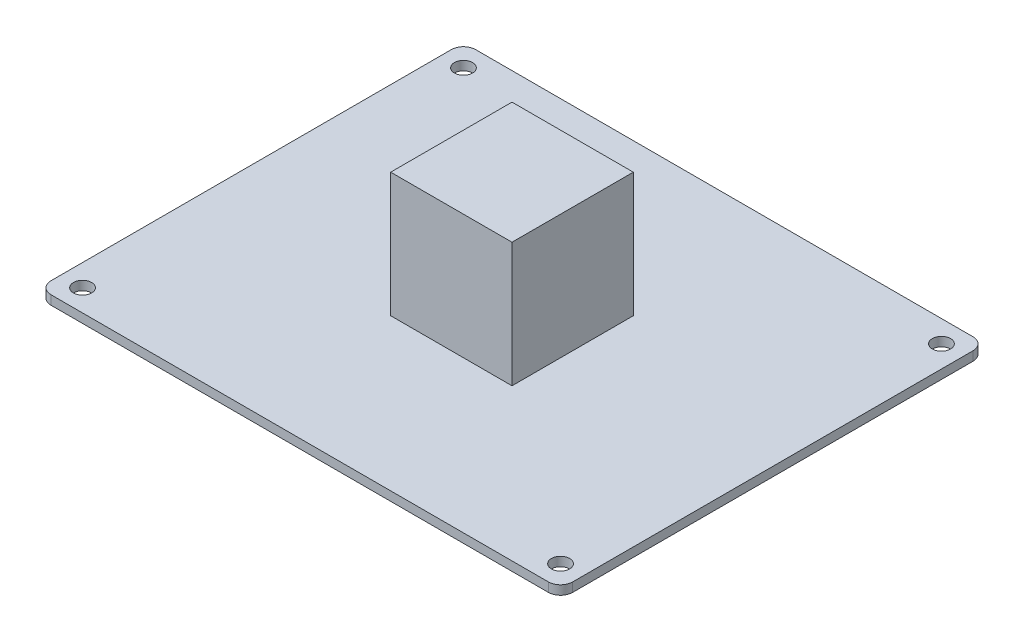
from build123d import *

# Parameters (mm, degrees)
SKETCH1_W             = 86
SKETCH1_H             = 70
BOSS_EXTRUDE1_DEPTH   = 1.5
FILLET1_R             = 2
SKETCH2_W             = 20
SKETCH2_H             = 20
BOSS_EXTRUDE2_DEPTH   = 22
F_1_0MM_DOWEL_HOLE1_D = 3


with BuildPart() as part:
    # Sketch1 → Boss-Extrude1 (new body)
    with BuildSketch(Plane(origin=(0, 0, 0), x_dir=(1, 0, 0), z_dir=(0, 1, 0))):
        Rectangle(SKETCH1_W, SKETCH1_H)
    extrude(amount=BOSS_EXTRUDE1_DEPTH)

    # Fillet1
    fillet1_edges = [part.edges().sort_by_distance(p)[0] for p in [
        (-43, 0.75, 35),
        (-43, 0.75, -35),
        (43, 0.75, -35),
        (43, 0.75, 35),
    ]]
    fillet(fillet1_edges, radius=FILLET1_R)

    # Sketch2 → Boss-Extrude2 (add)
    with BuildSketch(Plane.XZ):
        Rectangle(SKETCH2_W, SKETCH2_H)
    extrude(amount=-BOSS_EXTRUDE2_DEPTH)

    # Ø1.0mm Dowel Hole1 (through all)
    with Locations(Plane(origin=(-39.4, 1.5, -31.4), x_dir=(0, 0, 1), z_dir=(0, 1, 0))):
        with Locations((0, 0), (0, 78.8), (62.8, 0), (62.8, 78.8)):
            Hole(F_1_0MM_DOWEL_HOLE1_D / 2)


solid = part.part
